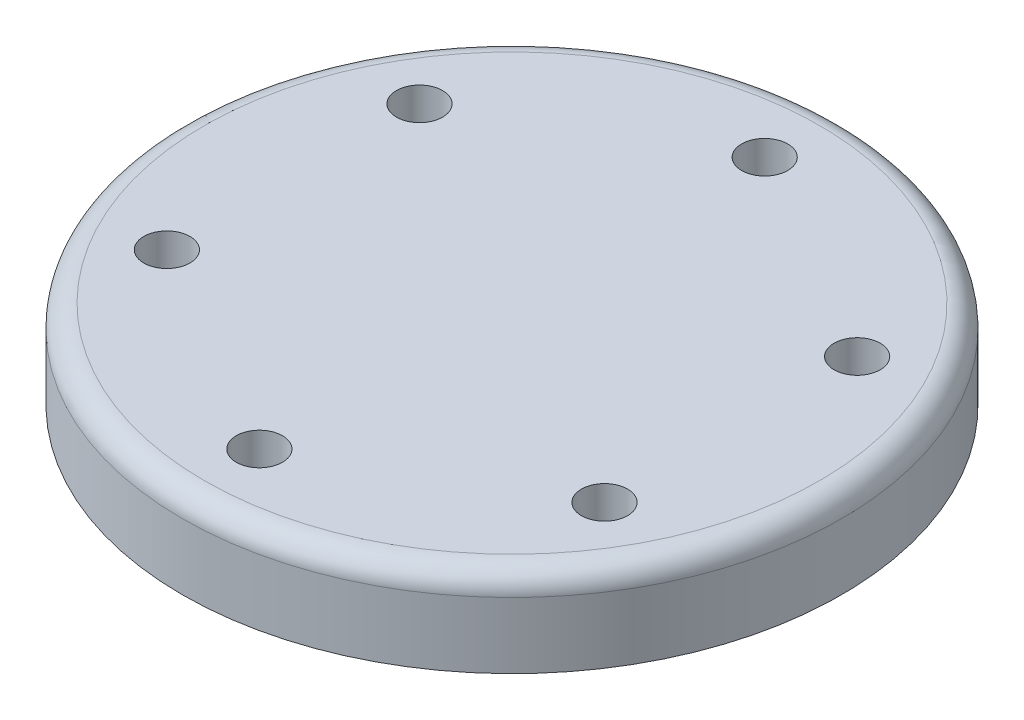
from build123d import *

# Parameters (mm, degrees)
SKETCH1_R           = 30
SKETCH1_R_2         = 2.1
BOSS_EXTRUDE1_DEPTH = 8
FILLET1_R           = 2


with BuildPart() as part:
    # Sketch1 → Boss-Extrude1 (new body)
    with BuildSketch(Plane(origin=(0, 0, 0), x_dir=(1, 0, 0), z_dir=(0, 1, 0))):
        Circle(SKETCH1_R)
        with Locations((0, 23)):
            Circle(SKETCH1_R_2, mode=Mode.SUBTRACT)
        with Locations((19.919084287, 11.500866025)):
            Circle(SKETCH1_R_2, mode=Mode.SUBTRACT)
        with Locations((19.920084287, -11.499133975)):
            Circle(SKETCH1_R_2, mode=Mode.SUBTRACT)
        with Locations((0.002, -23)):
            Circle(SKETCH1_R_2, mode=Mode.SUBTRACT)
        with Locations((-19.917084287, -11.500866025)):
            Circle(SKETCH1_R_2, mode=Mode.SUBTRACT)
        with Locations((-19.918084287, 11.499133975)):
            Circle(SKETCH1_R_2, mode=Mode.SUBTRACT)
    extrude(amount=BOSS_EXTRUDE1_DEPTH)

    # Fillet1
    fillet1_edges = [part.edges().sort_by_distance(p)[0] for p in [
        (-30, 8, 0),
    ]]
    fillet(fillet1_edges, radius=FILLET1_R)


solid = part.part
